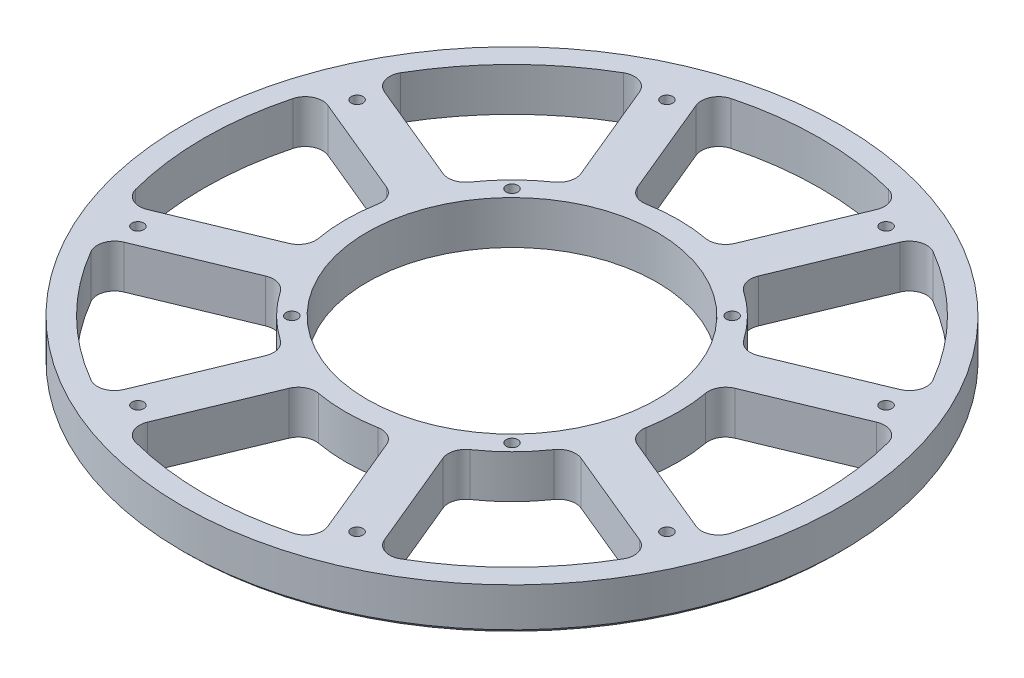
from build123d import *

# Parameters (mm, degrees)
SKETCH2_W                = 76.2
SKETCH2_H                = 10
F_6_32_TAPPED_HOLE1_D    = 2.7051
CIRPATTERN3_COUNT        = 4
CUT_EXTRUDE1_DEPTH       = 109.226059708
FILLET1_R                = 4
CIRPATTERN4_COUNT        = 8
FILLET1_OF_CIRPATTERN4_R = 4
CHAMFER2_SIZE            = 1
SKETCH9_R                = 33.5
CUT_EXTRUDE2_DEPTH       = 109.226059708


with BuildPart() as part:
    # Sketch2 → Revolve1 (revolve)
    with BuildSketch(Plane(origin=(0, 0, 0), x_dir=(0, 0, -1), z_dir=(1, 0, 0))):
        with Locations((-38.1, 5)):
            Rectangle(SKETCH2_W, SKETCH2_H)
    revolve(axis=Axis((0, -0.5, 0), (0, 1, 0)))

    # #6-32 Tapped Hole1 (through all)
    with Locations(Plane(origin=(0, 10, 0), x_dir=(1, 0, 0), z_dir=(0, 1, 0))):
        with Locations((-25.333643223, 61.160825052), (-61.160825052, 25.333643223), (-25.455844123, 25.455844123)):
            f_6_32_tapped_hole1 = Hole(F_6_32_TAPPED_HOLE1_D / 2)

    # CirPattern3: #6-32 Tapped Hole1 ×4 about axis
    cirpattern3_axis = Axis((0, -0.5, 0), (0, 1, 0))
    for i in range(1, CIRPATTERN3_COUNT):
        add(f_6_32_tapped_hole1.rotate(cirpattern3_axis, i * 360 / CIRPATTERN3_COUNT), mode=Mode.SUBTRACT)

    # Sketch8 → Cut-Extrude1 (cut, through all)
    with BuildSketch(Plane(origin=(0, 10, 0), x_dir=(1, 0, 0), z_dir=(0, 1, 0))):
        with BuildLine():
            Line((-9.989138252, 37.181542692), (-22.560395095, 67.53124146))
            ThreePointArc((-22.560395095, 67.53124146), (0, 71.2), (22.560395095, 67.53124146))
            Line((22.560395095, 67.53124146), (9.989138252, 37.181542692))
            ThreePointArc((9.989138252, 37.181542692), (0, 38.5), (-9.989138252, 37.181542692))
        make_face()
    cut_extrude1 = extrude(amount=-CUT_EXTRUDE1_DEPTH, mode=Mode.SUBTRACT)

    # Fillet1
    fillet1_edges = [part.edges().sort_by_distance(p)[0] for p in [
        (9.989138252, 5, -37.181542692),
        (22.560395095, 5, -67.53124146),
        (-9.989138252, 5, -37.181542692),
        (-22.560395095, 5, -67.53124146),
    ]]
    fillet(fillet1_edges, radius=FILLET1_R)

    # CirPattern4: Cut-Extrude1 ×8 about axis
    cirpattern4_axis = Axis((0, -0.5, 0), (0, 1, 0))
    for i in range(1, CIRPATTERN4_COUNT):
        add(cut_extrude1.rotate(cirpattern4_axis, i * 360 / CIRPATTERN4_COUNT), mode=Mode.SUBTRACT)

    # Fillet1 of CirPattern4
    fillet1_of_cirpattern4_edges = [part.edges().sort_by_distance(p)[0] for p in [
        (-19.227933577, 5, -33.354708369),
        (-31.79919042, 5, -63.704407136),
        (-33.354708369, 5, -19.227933577),
        (-63.704407136, 5, -31.79919042),
        (-37.181542692, 5, -9.989138252),
        (-67.53124146, 5, -22.560395095),
        (-37.181542692, 5, 9.989138252),
        (-67.53124146, 5, 22.560395095),
        (-33.354708369, 5, 19.227933577),
        (-63.704407136, 5, 31.79919042),
        (-19.227933577, 5, 33.354708369),
        (-31.79919042, 5, 63.704407136),
        (-9.989138252, 5, 37.181542692),
        (-22.560395095, 5, 67.53124146),
        (9.989138252, 5, 37.181542692),
        (22.560395095, 5, 67.53124146),
        (19.227933577, 5, 33.354708369),
        (31.79919042, 5, 63.704407136),
        (33.354708369, 5, 19.227933577),
        (63.704407136, 5, 31.79919042),
        (37.181542692, 5, 9.989138252),
        (67.53124146, 5, 22.560395095),
        (37.181542692, 5, -9.989138252),
        (67.53124146, 5, -22.560395095),
        (33.354708369, 5, -19.227933577),
        (63.704407136, 5, -31.79919042),
        (19.227933577, 5, -33.354708369),
        (31.79919042, 5, -63.704407136),
    ]]
    fillet(fillet1_of_cirpattern4_edges, radius=FILLET1_OF_CIRPATTERN4_R)

    # Chamfer2
    chamfer2_edges = [part.edges().sort_by_distance(p)[0] for p in [
        (0, 0, -76.2),
    ]]
    chamfer(chamfer2_edges, length=CHAMFER2_SIZE)

    # Sketch9 → Cut-Extrude2 (cut, through all)
    with BuildSketch(Plane(origin=(0, 10, 0), x_dir=(1, 0, 0), z_dir=(0, 1, 0))):
        Circle(SKETCH9_R)
    extrude(amount=-CUT_EXTRUDE2_DEPTH, mode=Mode.SUBTRACT)


solid = part.part
